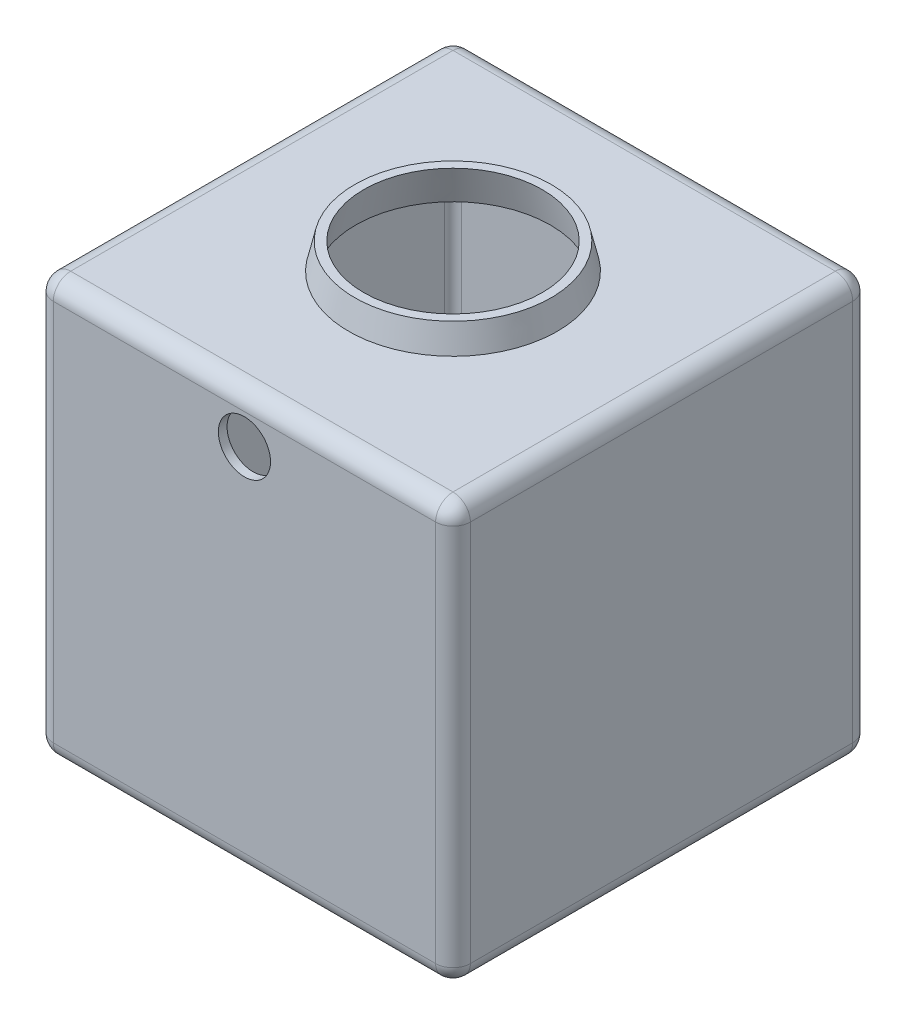
from build123d import *

# Parameters (mm, degrees)
SKETCH1_W               = 480
SKETCH1_H               = 480
BOSS_EXTRUDE1_DEPTH     = 240
FILLET1_R               = 20
SHELL1_T                = -10
CUT_EXTRUDE1_DEPTH      = 741.337760755
CUT_EXTRUDE1_DEPTH_BACK = 741.337760755
SKETCH3_R               = 30


with BuildPart() as part:
    # Sketch1 → Boss-Extrude1 (new, symmetric)
    with BuildSketch(Plane.XY):
        with Locations((240, -240)):
            Rectangle(SKETCH1_W, SKETCH1_H)
    extrude(amount=BOSS_EXTRUDE1_DEPTH, both=True)

    # Fillet1
    fillet1_edges = [part.edges().sort_by_distance(p)[0] for p in [
        (0, 0, 0),
        (0, -480, 0),
        (240, 0, 240),
        (240, -480, 240),
        (0, -240, 240),
        (240, -480, -240),
        (240, 0, -240),
        (0, -240, -240),
        (480, -480, 0),
        (480, -240, 240),
        (480, 0, 0),
        (480, -240, -240),
    ]]
    fillet(fillet1_edges, radius=FILLET1_R)

    # Sketch2 → Revolve1 (revolve)
    with BuildSketch(Plane.XY):
        Polygon((240, 0), (360, 0), (353, 30), (240, 30), align=None)
        Polygon((360, -480), (353, -510), (240, -510), (240, -480), align=None)
    revolve(axis=Axis((240, 0, 0), (0, 1, 0)))

    # Shell1
    shell1_openings = [part.faces().sort_by_distance(p)[0] for p in [
        (240, -510, 0),
        (240, 30, 0),
    ]]
    offset(amount=SHELL1_T, openings=shell1_openings, kind=Kind.INTERSECTION)

    # Sketch3 → Cut-Extrude1 (cut, two sides: drawn at the far end of the back side and taken through both)
    with BuildSketch(Plane.XY.offset(-CUT_EXTRUDE1_DEPTH_BACK)):
        with Locations((240, -55)):
            Circle(SKETCH3_R)
    extrude(amount=CUT_EXTRUDE1_DEPTH + CUT_EXTRUDE1_DEPTH_BACK, mode=Mode.SUBTRACT)


solid = part.part
